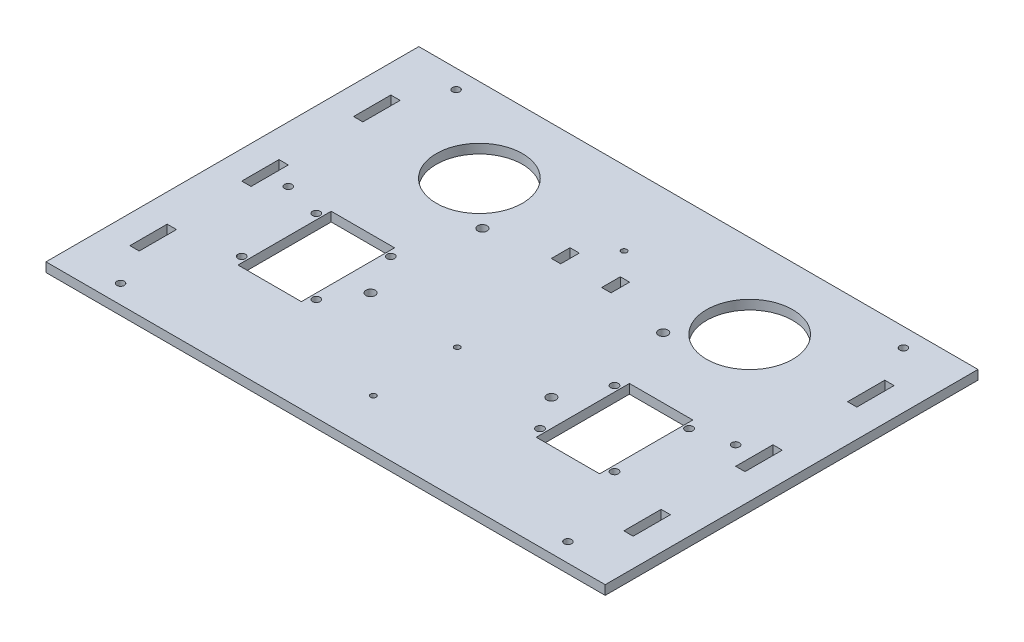
from build123d import *

# Parameters (mm, degrees)
SKETCH_1_W          = 300
SKETCH_1_H          = 200
SKETCH_1_R          = 2
SKETCH_1_W_2        = 5
SKETCH_1_H_2        = 20
EXTRUDE_1_DEPTH     = 5
SKETCH_3_R          = 1.5
SKETCH_3_R_2        = 2.5
SKETCH_3_R_3        = 23.1
SKETCH_3_R_4        = 2.05
SKETCH_3_W          = 34
SKETCH_3_H          = 50
SKETCH_3_W_2        = 5
SKETCH_3_H_2        = 10
CUT_EXTRUDE_1_DEPTH = 181.346887969


with BuildPart() as part:
    # 草圖1 → 填料-伸長1 (new body)
    with BuildSketch(Plane(origin=(0, 0, 0), x_dir=(1, 0, 0), z_dir=(0, 1, 0))):
        Rectangle(SKETCH_1_W, SKETCH_1_H)
        with Locations((-120, 0)):
            Circle(SKETCH_1_R, mode=Mode.SUBTRACT)
        with Locations((120, 0)):
            Circle(SKETCH_1_R, mode=Mode.SUBTRACT)
        with Locations((-120, 90)):
            Circle(SKETCH_1_R, mode=Mode.SUBTRACT)
        with Locations((120, 90)):
            Circle(SKETCH_1_R, mode=Mode.SUBTRACT)
        with Locations((120, -90)):
            Circle(SKETCH_1_R, mode=Mode.SUBTRACT)
        with Locations((-120, -90)):
            Circle(SKETCH_1_R, mode=Mode.SUBTRACT)
        with Locations((132.5, -60)):
            Rectangle(SKETCH_1_W_2, SKETCH_1_H_2, mode=Mode.SUBTRACT)
        with Locations((-132.5, 60)):
            Rectangle(SKETCH_1_W_2, SKETCH_1_H_2, mode=Mode.SUBTRACT)
        with Locations((-132.5, 0)):
            Rectangle(SKETCH_1_W_2, SKETCH_1_H_2, mode=Mode.SUBTRACT)
        with Locations((-132.5, -60)):
            Rectangle(SKETCH_1_W_2, SKETCH_1_H_2, mode=Mode.SUBTRACT)
        with Locations((132.5, 0)):
            Rectangle(SKETCH_1_W_2, SKETCH_1_H_2, mode=Mode.SUBTRACT)
        with Locations((132.5, 60)):
            Rectangle(SKETCH_1_W_2, SKETCH_1_H_2, mode=Mode.SUBTRACT)
    extrude(amount=EXTRUDE_1_DEPTH)

    # 草圖3 → 除料-伸長1 (cut, through all)
    with BuildSketch(Plane(origin=(0, 5, 0), x_dir=(1, 0, 0), z_dir=(0, 1, 0))):
        with Locations((0, -74.386127875)):
            Circle(SKETCH_3_R)
        with Locations((0, -29.386127875)):
            Circle(SKETCH_3_R)
        with Locations((-48.5, 32.613872125)):
            Circle(SKETCH_3_R_2)
        with Locations((48.5, 32.613872125)):
            Circle(SKETCH_3_R_2)
        with Locations((48.5, -27.386127875)):
            Circle(SKETCH_3_R_2)
        with Locations((-48.5, -27.386127875)):
            Circle(SKETCH_3_R_2)
        with Locations((-72.5, 55)):
            Circle(SKETCH_3_R_3)
        with Locations((72.5, 55)):
            Circle(SKETCH_3_R_3)
        with Locations((0, 60.113872125)):
            Circle(SKETCH_3_R)
        with Locations((-100, -45)):
            Circle(SKETCH_3_R_4)
        with Locations((-60, -45)):
            Circle(SKETCH_3_R_4)
        with Locations((-60, -5)):
            Circle(SKETCH_3_R_4)
        with Locations((-100, -5)):
            Circle(SKETCH_3_R_4)
        with Locations((100, -5)):
            Circle(SKETCH_3_R_4)
        with Locations((60, -5)):
            Circle(SKETCH_3_R_4)
        with Locations((60, -45)):
            Circle(SKETCH_3_R_4)
        with Locations((100, -45)):
            Circle(SKETCH_3_R_4)
        with Locations((-80, -25)):
            Rectangle(SKETCH_3_W, SKETCH_3_H)
        with Locations((80, -25)):
            Rectangle(SKETCH_3_W, SKETCH_3_H)
        with Locations((-13.5, 42.113872125)):
            Rectangle(SKETCH_3_W_2, SKETCH_3_H_2)
        with Locations((13.5, 42.113872125)):
            Rectangle(SKETCH_3_W_2, SKETCH_3_H_2)
    extrude(amount=-CUT_EXTRUDE_1_DEPTH, mode=Mode.SUBTRACT)


solid = part.part
